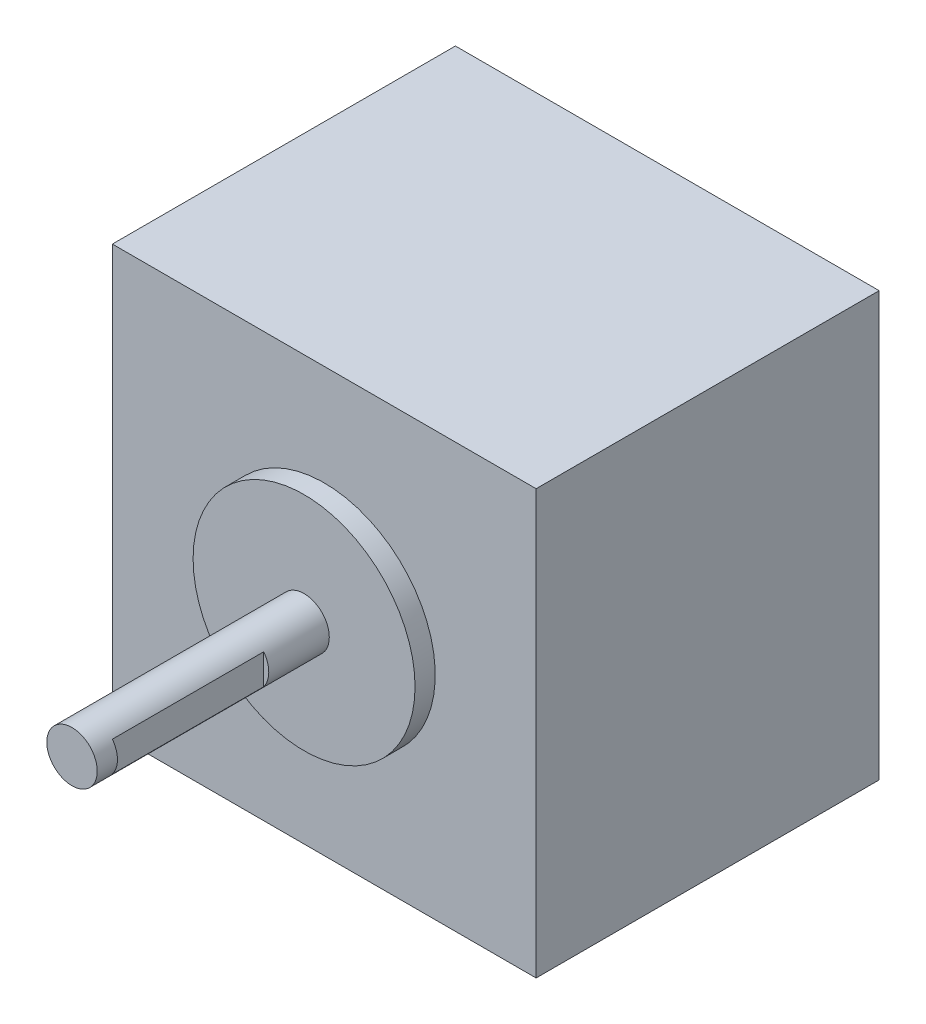
from build123d import *

# Parameters (mm, degrees)
SKETCH1_W           = 42
SKETCH1_H           = 42
BOSS_EXTRUDE1_DEPTH = 34
SKETCH2_R           = 2.5
BOSS_EXTRUDE2_DEPTH = 25
SKETCH3_R           = 11
BOSS_EXTRUDE3_DEPTH = 2
SKETCH4_W           = 1
SKETCH4_H           = 6
CUT_EXTRUDE1_DEPTH  = 15


with BuildPart() as part:
    # Sketch1 → Boss-Extrude1 (new body)
    with BuildSketch(Plane.XY):
        Rectangle(SKETCH1_W, SKETCH1_H)
    extrude(amount=-BOSS_EXTRUDE1_DEPTH)

    # Sketch2 → Boss-Extrude2 (add)
    with BuildSketch(Plane.XY):
        Circle(SKETCH2_R)
    extrude(amount=BOSS_EXTRUDE2_DEPTH)

    # Sketch3 → Boss-Extrude3 (add)
    with BuildSketch(Plane.XY):
        Circle(SKETCH3_R)
    extrude(amount=BOSS_EXTRUDE3_DEPTH)

    # Sketch4 → Cut-Extrude1 (cut)
    with BuildSketch(Plane.XY.offset(23)):
        with Locations((2.5, 0)):
            Rectangle(SKETCH4_W, SKETCH4_H)
    extrude(amount=-CUT_EXTRUDE1_DEPTH, mode=Mode.SUBTRACT)


solid = part.part
